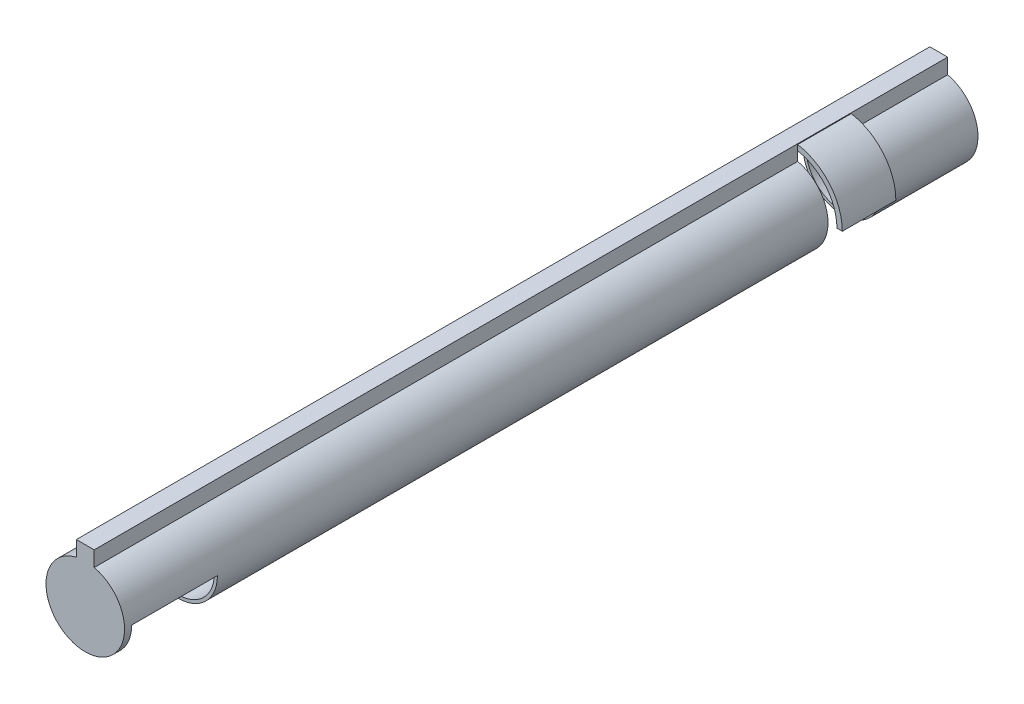
from build123d import *
from build123d.topology import SkipClean

# Parameters (mm, degrees)
SCHIZZO1_R                  = 11
SCHIZZO1_R_2                = 10.15
TUBO_DEPTH                  = 210
INGRESSOCAVI_DEPTH          = 27
SCHIZZO4_R                  = 11
SCHIZZO4_R_2                = 6.5
FONDOCORSA_DEPTH            = 3
SCHIZZO5_R                  = 11
TAPPO_DEPTH                 = 2
BASEINFERIORE_DEPTH         = 239
SCHIZZO7_R                  = 13.5
TAGLIOTUBO_DEPTH            = 15
SUPPORTOANELLO_DEPTH        = 15
FACILITAZIONECAVI_DEPTH     = 3
RACCORDOFACILITAZIONECAVI_R = 8


with BuildPart() as part:
    # Schizzo1 → Tubo (new body)
    with BuildSketch(Plane.XY):
        Circle(SCHIZZO1_R)
        Circle(SCHIZZO1_R_2, mode=Mode.SUBTRACT)
    extrude(amount=TUBO_DEPTH)

    # Schizzo2 → IngressoCavi (add)
    with BuildSketch(Plane.XY.offset(210)):
        with BuildLine():
            Line((0, -10.15), (0, -11))
            ThreePointArc((0, -11), (-7.778174593, 7.778174593), (11, 0))
            Line((11, 0), (10.15, 0))
            ThreePointArc((10.15, 0), (-7.177133829, 7.177133829), (0, -10.15))
        make_face()
    extrude(amount=INGRESSOCAVI_DEPTH)

    # Schizzo4 → FondoCorsa (add)
    with SkipClean():  # the faces are left unmerged after this step: merging them gives an invalid solid
        with BuildSketch(Plane.XY.offset(210)):
            Circle(SCHIZZO4_R)
            Circle(SCHIZZO4_R_2, mode=Mode.SUBTRACT)
        extrude(amount=FONDOCORSA_DEPTH)

    # Schizzo5 → Tappo (add)
    with SkipClean():  # the faces are left unmerged after this step: merging them gives an invalid solid
        with BuildSketch(Plane.XY.offset(237)):
            Circle(SCHIZZO5_R)
        extrude(amount=TAPPO_DEPTH)
    add(part.part.scale(1), mode=Mode.REPLACE)  # the faces are merged on a copy

    # Schizzo6 → BaseInferiore (add)
    with BuildSketch(Plane.XY):
        Polygon((-2.5, 11), (-2.5, 15), (2.5, 15), (2.5, 11), (2.5, 10.712142643), (-2.5, 10.712142643), align=None)
    extrude(amount=BASEINFERIORE_DEPTH)

    # Schizzo7 → TaglioTubo (cut)
    with BuildSketch(Plane.XY.offset(27)):
        Circle(SCHIZZO7_R)
    extrude(amount=TAGLIOTUBO_DEPTH, mode=Mode.SUBTRACT)

    # Schizzo8 → SupportoAnello (add)
    with BuildSketch(Plane.XY.offset(27)):
        with BuildLine():
            Line((0, 13.5), (0, 15))
            ThreePointArc((0, 15), (10.606601718, 10.606601718), (15, 0))
            Line((15, 0), (13.5, 0))
            ThreePointArc((13.5, 0), (9.545941546, 9.545941546), (0, 13.5))
        make_face()
    extrude(amount=SUPPORTOANELLO_DEPTH)

    # Schizzo9 → FacilitazioneCavi (cut)
    with BuildSketch(Plane(origin=(0, 0, 210), x_dir=(-1, 0, 0), z_dir=(0, 0, -1))):
        with BuildLine():
            Line((0, -10.15), (0, 0))
            Line((0, 0), (-10.15, 0))
            ThreePointArc((-10.15, 0), (-7.177133829, -7.177133829), (0, -10.15))
        make_face()
    extrude(amount=-FACILITAZIONECAVI_DEPTH, mode=Mode.SUBTRACT)

    # RaccordoFacilitazioneCavi
    # the kernel refuses this fillet: 8 mm, written as the material it takes off along each edge
    with BuildSketch(Plane(origin=(6.5, 0, 200.875), x_dir=(1, 0, 0), z_dir=(0, 0, 1)), Plane(origin=(0, -6.5, 222.125), x_dir=(0, -1, 0), z_dir=(0, 0, -1))) as raccordofacilitazionecavi_piece_1:
        with BuildLine():
            CenterArc((5.779433498, 7.711388525), RACCORDOFACILITAZIONECAVI_R, 212.128500683, 42.43446725)
            Line((-0.995426363, 3.456829339), (-1.13092356, 3.371738155))
            ThreePointArc((-1.13092356, 3.371738155), (-0.407564337, 1.754373873), (-0.16, 0))
            Line((-0.16, 0), (0, -0.16))
            ThreePointArc((0, -0.16), (1.825, -0.16), (3.60741133, -0.15422777))
            Line((3.60741133, -0.15422777), (3.65, 0))
        make_face()
    extrude(amount=21.25, mode=Mode.SUBTRACT)


solid = part.part
